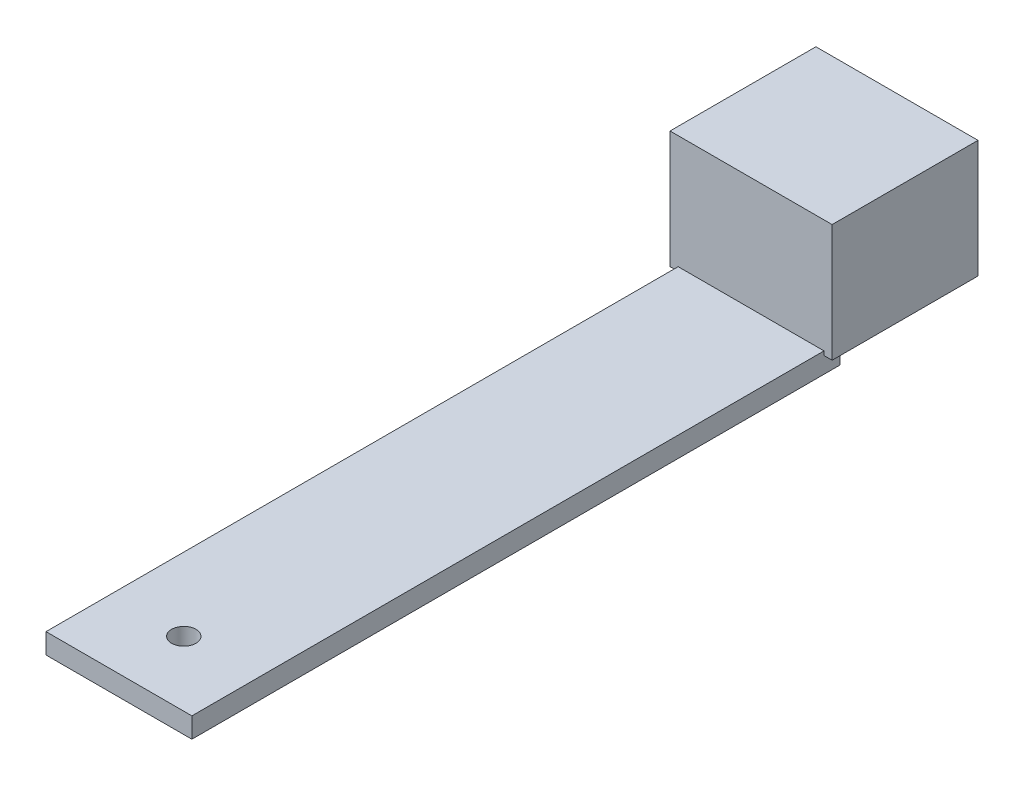
from build123d import *

# Parameters (mm, degrees)
S_BOX1_W     = 18
S_BOX1_H     = 2.5
BOSS_1_DEPTH = 80
S_BOX2_W     = 20
S_BOX2_H     = 14.5
BOSS_2_DEPTH = 18
S_HOLE3_R    = 1.5
HOLE_3_DEPTH = 2.7


with BuildPart() as part:
    # S_box1 → Boss_1 (new body)
    with BuildSketch(Plane.XY.offset(-72)):
        with Locations((0, -19.45)):
            Rectangle(S_BOX1_W, S_BOX1_H)
    extrude(amount=BOSS_1_DEPTH)

    # S_box2 → Boss_2 (add)
    with BuildSketch(Plane.XY.offset(-88)):
        with Locations((0, -11.45)):
            Rectangle(S_BOX2_W, S_BOX2_H)
    extrude(amount=BOSS_2_DEPTH)

    # S_hole3 → Hole_3 (cut)
    with BuildSketch(Plane(origin=(0, -20.8, 0), x_dir=(1, 0, 0), z_dir=(0, 1, 0))):
        Circle(S_HOLE3_R)
    extrude(amount=HOLE_3_DEPTH, mode=Mode.SUBTRACT)


solid = part.part
